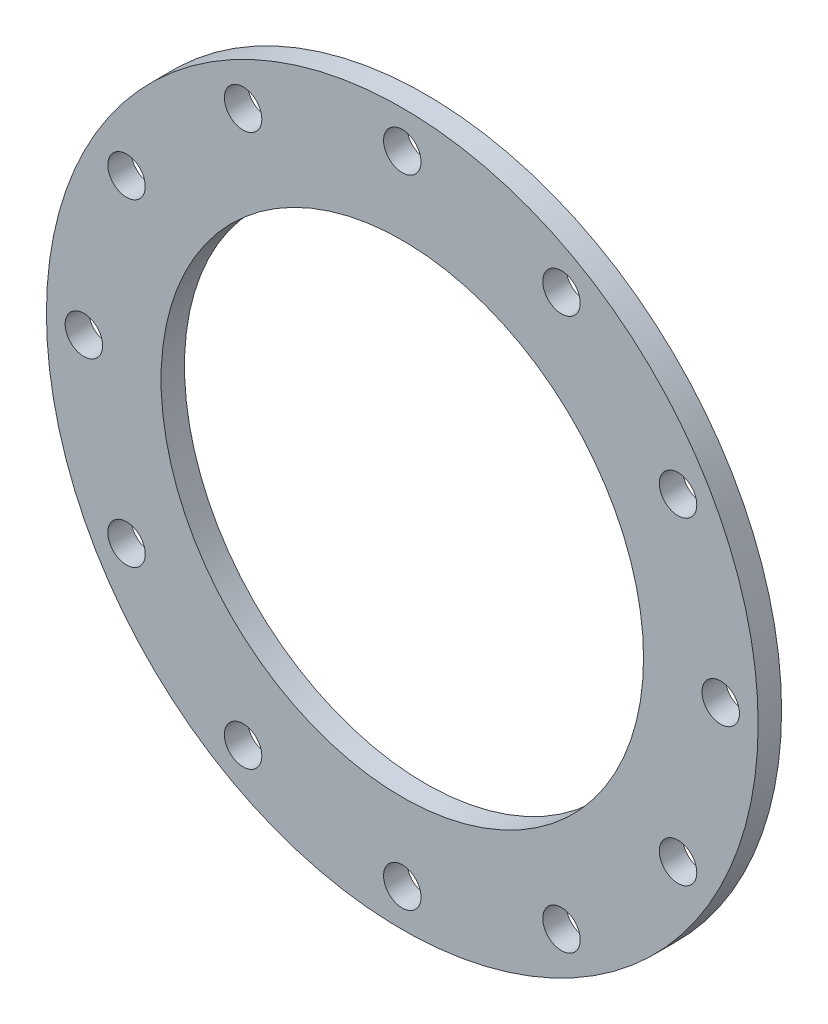
from build123d import *

# Parameters (mm, degrees)
PROFILE_SKETCH_R       = 241.3
PROFILE_SKETCH_R_2     = 163.576
BOSS_EXTRUDE1_DEPTH    = 7.9375
F_1_1_DIAMETER_HOLE1_D = 25.4
CIRPATTERN1_COUNT      = 12


with BuildPart() as part:
    # Profile Sketch → Boss-Extrude1 (new, symmetric)
    with BuildSketch(Plane.XY):
        Circle(PROFILE_SKETCH_R)
        Circle(PROFILE_SKETCH_R_2, mode=Mode.SUBTRACT)
    extrude(amount=BOSS_EXTRUDE1_DEPTH, both=True)

    # 1 (1) Diameter Hole1 (through all)
    with Locations(Plane(origin=(215.9, 0, 7.9375), x_dir=(1, 0, 0), z_dir=(0, 0, 1))):
        with Locations((0, 0)):
            f_1_1_diameter_hole1 = Hole(F_1_1_DIAMETER_HOLE1_D / 2)

    # CirPattern1: 1 (1) Diameter Hole1 ×12 about axis
    cirpattern1_axis = Axis((0, 0, 7.9375), (0, 0, -1))
    for i in range(1, CIRPATTERN1_COUNT):
        add(f_1_1_diameter_hole1.rotate(cirpattern1_axis, i * 360 / CIRPATTERN1_COUNT), mode=Mode.SUBTRACT)


solid = part.part
